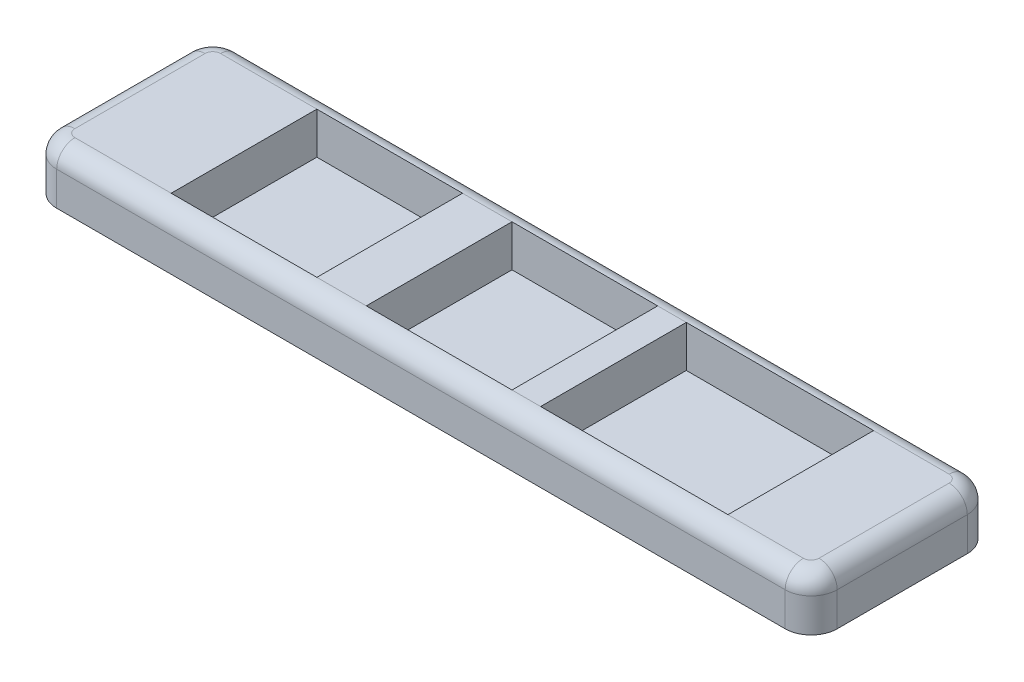
from build123d import *

# Parameters (mm, degrees)
SKETCH1_W           = 150
SKETCH1_H           = 35
SKETCH1_W_2         = 28
SKETCH1_H_2         = 28
SKETCH1_W_3         = 36
BOSS_EXTRUDE1_DEPTH = 10
SKETCH2_W           = 28
SKETCH2_H           = 28
SKETCH2_W_2         = 36
BOSS_EXTRUDE2_DEPTH = 2
FILLET3_R           = 3.5
FILLET4_R           = 5


# Some blends are built 0.0001 mm under size
with BuildPart() as part:
    # Sketch1 → Boss-Extrude1 (new body)
    with BuildSketch(Plane(origin=(0, 0, 0), x_dir=(1, 0, 0), z_dir=(0, 1, 0))):
        Rectangle(SKETCH1_W, SKETCH1_H)
        Rectangle(SKETCH1_W_2, SKETCH1_H_2, mode=Mode.SUBTRACT)
        with Locations((-37.5, 0)):
            Rectangle(SKETCH1_W_2, SKETCH1_H_2, mode=Mode.SUBTRACT)
        with Locations((37.5, 0)):
            Rectangle(SKETCH1_W_3, SKETCH1_H_2, mode=Mode.SUBTRACT)
    extrude(amount=BOSS_EXTRUDE1_DEPTH)

    # Sketch2 → Boss-Extrude2 (add)
    with BuildSketch(Plane.XZ):
        with Locations((-37.5, 0)):
            Rectangle(SKETCH2_W, SKETCH2_H)
        Rectangle(SKETCH2_W, SKETCH2_H)
        with Locations((37.5, 0)):
            Rectangle(SKETCH2_W_2, SKETCH2_H)
    extrude(amount=-BOSS_EXTRUDE2_DEPTH)

    # Fillet3
    fillet3_edges = [part.edges().sort_by_distance(p)[0] for p in [
        (-75, 10, 0),
        (0, 10, 17.5),
        (75, 10, 0),
        (0, 10, -17.5),
    ]]
    fillet(fillet3_edges, radius=FILLET3_R - 0.0001)  # a hair under: the kernel refuses the full size

    # Fillet4
    # the kernel refuses this fillet: 5 mm, written as the material it takes off along each edge
    with BuildSketch(Plane(origin=(70, 10, -12.5), x_dir=(1, 0, 0), z_dir=(0, 0, 1))) as fillet4_piece_1:
        with BuildLine():
            CenterArc((1.5001, -3.4999), 3.4999, 0, 90)
            Line((5, -3.4999), (5, 0))
            Line((5, 0), (1.5001, 0))
        make_face()
    revolve(axis=Axis((70, 10, -12.5), (0, 1, 0)), revolution_arc=90, mode=Mode.SUBTRACT)
    with BuildSketch(Plane(origin=(70, 10, 12.5), x_dir=(0, 0, 1), z_dir=(-1, 0, 0))) as fillet4_piece_2:
        with BuildLine():
            CenterArc((1.5001, -3.4999), 3.4999, 0, 90)
            Line((5, -3.4999), (5, 0))
            Line((5, 0), (1.5001, 0))
        make_face()
    revolve(axis=Axis((70, 10, 12.5), (0, 1, 0)), revolution_arc=90, mode=Mode.SUBTRACT)
    with BuildSketch(Plane(origin=(-70, 10, -12.5), x_dir=(0, 0, -1), z_dir=(1, 0, 0))) as fillet4_piece_3:
        with BuildLine():
            CenterArc((1.5001, -3.4999), 3.4999, 0, 90)
            Line((5, -3.4999), (5, 0))
            Line((5, 0), (1.5001, 0))
        make_face()
    revolve(axis=Axis((-70, 10, -12.5), (0, 1, 0)), revolution_arc=90, mode=Mode.SUBTRACT)
    with BuildSketch(Plane(origin=(-70, 10, 12.5), x_dir=(-1, 0, 0), z_dir=(0, 0, -1))) as fillet4_piece_4:
        with BuildLine():
            CenterArc((1.5001, -3.4999), 3.4999, 0, 90)
            Line((5, -3.4999), (5, 0))
            Line((5, 0), (1.5001, 0))
        make_face()
    revolve(axis=Axis((-70, 10, 12.5), (0, 1, 0)), revolution_arc=90, mode=Mode.SUBTRACT)
    with BuildSketch(Plane(origin=(-75, -12.5, 17.5), x_dir=(1, 0, 0), z_dir=(0, 1, 0)), Plane(origin=(-75, -12.5, -17.5), x_dir=(0, 0, 1), z_dir=(0, 1, 0))) as fillet4_piece_5:
        with BuildLine():
            CenterArc((FILLET4_R, FILLET4_R), FILLET4_R, 180, 90)
            Line((0, FILLET4_R), (0, 0))
            Line((0, 0), (FILLET4_R, 0))
        make_face()
    extrude(amount=22.5, mode=Mode.SUBTRACT)
    with BuildSketch(Plane(origin=(75, -12.5, -17.5), x_dir=(0, 0, 1), z_dir=(0, 1, 0)), Plane(origin=(75, -12.5, 17.5), x_dir=(-1, 0, 0), z_dir=(0, 1, 0))) as fillet4_piece_6:
        with BuildLine():
            CenterArc((FILLET4_R, -FILLET4_R), FILLET4_R, 90, 90)
            Line((0, -FILLET4_R), (0, 0))
            Line((0, 0), (FILLET4_R, 0))
        make_face()
    extrude(amount=22.5, mode=Mode.SUBTRACT)


solid = part.part
